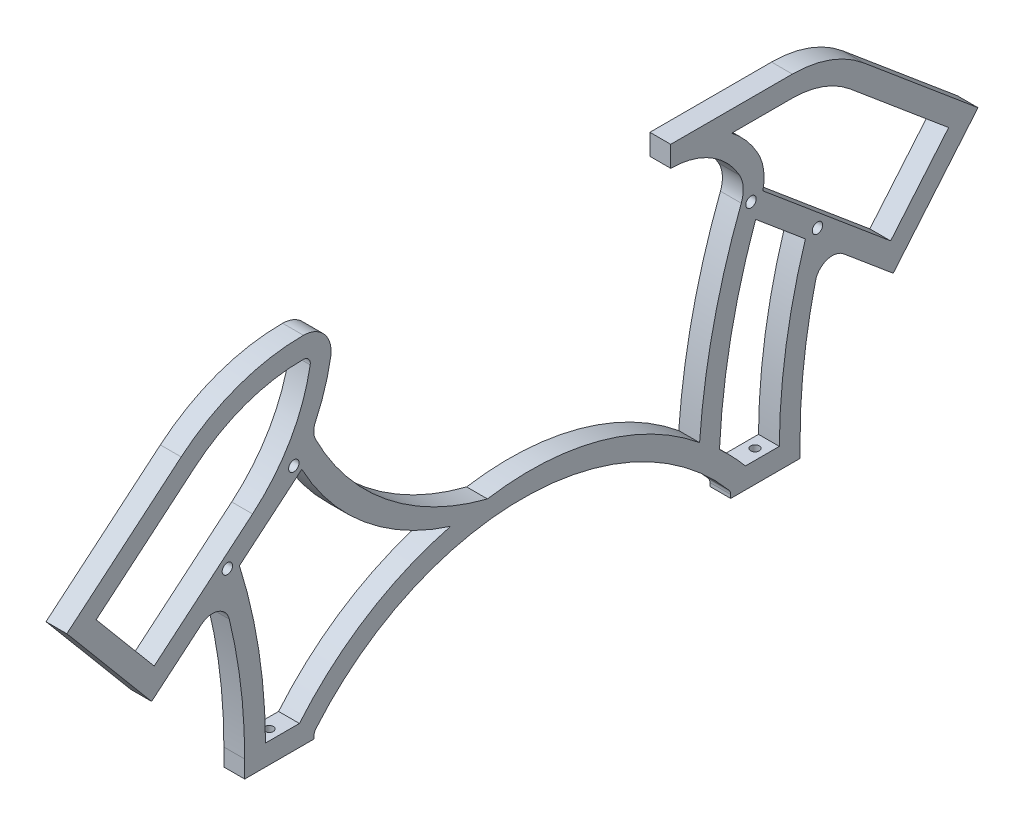
from build123d import *

# Parameters (mm, degrees)
SKETCH1_R                   = 1.5
BOSS_EXTRUDE1_DEPTH         = 6
TAP_DRILL_FOR_M3_TAP1_D     = 2.5
TAP_DRILL_FOR_M3_TAP1_DEPTH = 10
TAP_DRILL_FOR_M3_TAP1_TIP   = 0.751075774


with BuildPart() as part:
    # Sketch1 → Boss-Extrude1 (new body)
    with BuildSketch(Plane(origin=(0, 0, 0), x_dir=(0, 0, -1), z_dir=(1, 0, 0))):
        with BuildLine():
            Line((0, 0), (0, 5))
            ThreePointArc((0, 5), (-1.11530478, 23.695439246), (-4.445398393, 42.12568151))
            ThreePointArc((-4.445398393, 42.12568151), (-7.744700468, 45.695838669), (-12.51798832, 44.775436905))
            Line((-12.51798832, 44.775436905), (-26.819014908, 32.77545077))
            Line((-26.819014908, 32.77545077), (-51.244944076, 61.885139609))
            Line((-51.244944076, 61.885139609), (-18.305033022, 89.525006825))
            ThreePointArc((-18.305033022, 89.525006825), (-1.818865856, 99.017171366), (16.92732781, 102.253700147))
            ThreePointArc((16.92732781, 102.253700147), (23.017620401, 99.396091574), (24.774247269, 92.902105691))
            ThreePointArc((24.774247269, 92.902105691), (23.044454009, 85.7535683), (20.36635808, 78.903635909))
            ThreePointArc((20.36635808, 78.903635909), (19.889404321, 76.768661643), (20.369570291, 74.634407525))
            ThreePointArc((20.369570291, 74.634407525), (40.825254077, 49.386713426), (69.927325859, 34.931594109))
            ThreePointArc((69.927325859, 34.931594109), (102.255322943, 33.236872757), (131.038953114, 18.422214133))
            ThreePointArc((131.038953114, 18.422214133), (135.053054197, 45.730612009), (143.049654568, 72.148711573))
            ThreePointArc((143.049654568, 72.148711573), (143.600406765, 75.857813422), (142.515207521, 79.447117967))
            ThreePointArc((142.515207521, 79.447117967), (134.181317508, 87.900458737), (122.722454698, 91))
            Line((122.722454698, 91), (122.722454698, 97))
            Line((122.722454698, 97), (157.767658064, 97))
            ThreePointArc((157.767658064, 97), (168.695367031, 95.073150072), (178.305033022, 89.525006825))
            Line((178.305033022, 89.525006825), (211.244944076, 61.885139609))
            Line((211.244944076, 61.885139609), (186.819014908, 32.77545077))
            Line((186.819014908, 32.77545077), (172.51798832, 44.775436905))
            ThreePointArc((172.51798832, 44.775436905), (167.744700468, 45.695838669), (164.445398393, 42.12568151))
            ThreePointArc((164.445398393, 42.12568151), (161.11530478, 23.695439246), (160, 5))
            Line((160, 5), (160, 0))
            Line((160, 0), (140, 0))
            Line((140, 0), (140, 1))
            ThreePointArc((140, 1), (139.878940602, 1.68526069), (139.530417786, 2.287564134))
            ThreePointArc((139.530417786, 2.287564134), (80, 30), (20.469582214, 2.287564134))
            ThreePointArc((20.469582214, 2.287564134), (20.121059398, 1.68526069), (20, 1))
            Line((20, 1), (20, 0))
            Line((20, 0), (0, 0))
        make_face()
        with Locations((-5, 55)):
            Circle(SKETCH1_R, mode=Mode.SUBTRACT)
        with Locations((165, 55)):
            Circle(SKETCH1_R, mode=Mode.SUBTRACT)
        with Locations((14.151111078, 71.069690242)):
            Circle(SKETCH1_R, mode=Mode.SUBTRACT)
        with Locations((145.848888922, 71.069690242)):
            Circle(SKETCH1_R, mode=Mode.SUBTRACT)
        with BuildLine():
            Line((161.526724153, 53.998202614), (147.177477152, 66.038650481))
            ThreePointArc((147.177477152, 66.038650481), (140.042110809, 40.323418422), (136.772092644, 13.837694081))
            ThreePointArc((136.772092644, 13.837694081), (140.63670515, 10.039758735), (144.247784225, 6))
            Line((144.247784225, 6), (154.003062816, 6))
            ThreePointArc((154.003062816, 6), (155.9693252, 30.280554506), (161.526724153, 53.998202614))
        make_face(mode=Mode.SUBTRACT)
        with BuildLine():
            Line((16.444714406, 69.078030081), (-1.526724153, 53.998202614))
            ThreePointArc((-1.526724153, 53.998202614), (4.0306748, 30.280554506), (5.996937184, 6))
            Line((5.996937184, 6), (15.752215775, 6))
            ThreePointArc((15.752215775, 6), (35.365628586, 23.12332131), (59.288092319, 33.39998535))
            ThreePointArc((59.288092319, 33.39998535), (34.351936245, 47.018719188), (16.444714406, 69.078030081))
        make_face(mode=Mode.SUBTRACT)
        with BuildLine():
            Line((149.283619971, 72.103830554), (186.079473907, 41.228443087))
            Line((186.079473907, 41.228443087), (202.791951759, 61.145598608))
            Line((202.791951759, 61.145598608), (174.448307363, 84.928740167))
            ThreePointArc((174.448307363, 84.928740167), (166.643246171, 89.434994347), (157.767658064, 91))
            Line((157.767658064, 91), (140.294438351, 91))
            ThreePointArc((140.294438351, 91), (144.447052727, 87.07103499), (147.73958748, 82.397686394))
            ThreePointArc((147.73958748, 82.397686394), (149.462088452, 77.393326946), (149.283619971, 72.103830554))
        make_face(mode=Mode.SUBTRACT)
        with BuildLine():
            Line((-14.448307363, 84.928740167), (-42.791951759, 61.145598608))
            Line((-42.791951759, 61.145598608), (-26.079473907, 41.228443087))
            Line((-26.079473907, 41.228443087), (2.264170488, 65.011584646))
            ThreePointArc((2.264170488, 65.011584646), (13.128371721, 77.990356324), (18.860510459, 93.915869445))
            ThreePointArc((18.860510459, 93.915869445), (18.421353742, 95.539365916), (16.898780595, 96.253768059))
            ThreePointArc((16.898780595, 96.253768059), (0.219836356, 93.374149721), (-14.448307363, 84.928740167))
        make_face(mode=Mode.SUBTRACT)
    extrude(amount=BOSS_EXTRUDE1_DEPTH)

    # Tap Drill for M3 Tap1
    with Locations(Plane(origin=(0, 0, 0), x_dir=(-1, 0, 0), z_dir=(0, -1, 0))):
        with Locations((-3, 10), (-3, 150)):
            Hole(TAP_DRILL_FOR_M3_TAP1_D / 2, depth=TAP_DRILL_FOR_M3_TAP1_DEPTH)
            with Locations((0, 0, -(TAP_DRILL_FOR_M3_TAP1_DEPTH + TAP_DRILL_FOR_M3_TAP1_TIP / 2))):  # 118° drill point
                Cone(0, TAP_DRILL_FOR_M3_TAP1_D / 2, TAP_DRILL_FOR_M3_TAP1_TIP, mode=Mode.SUBTRACT)


solid = part.part
